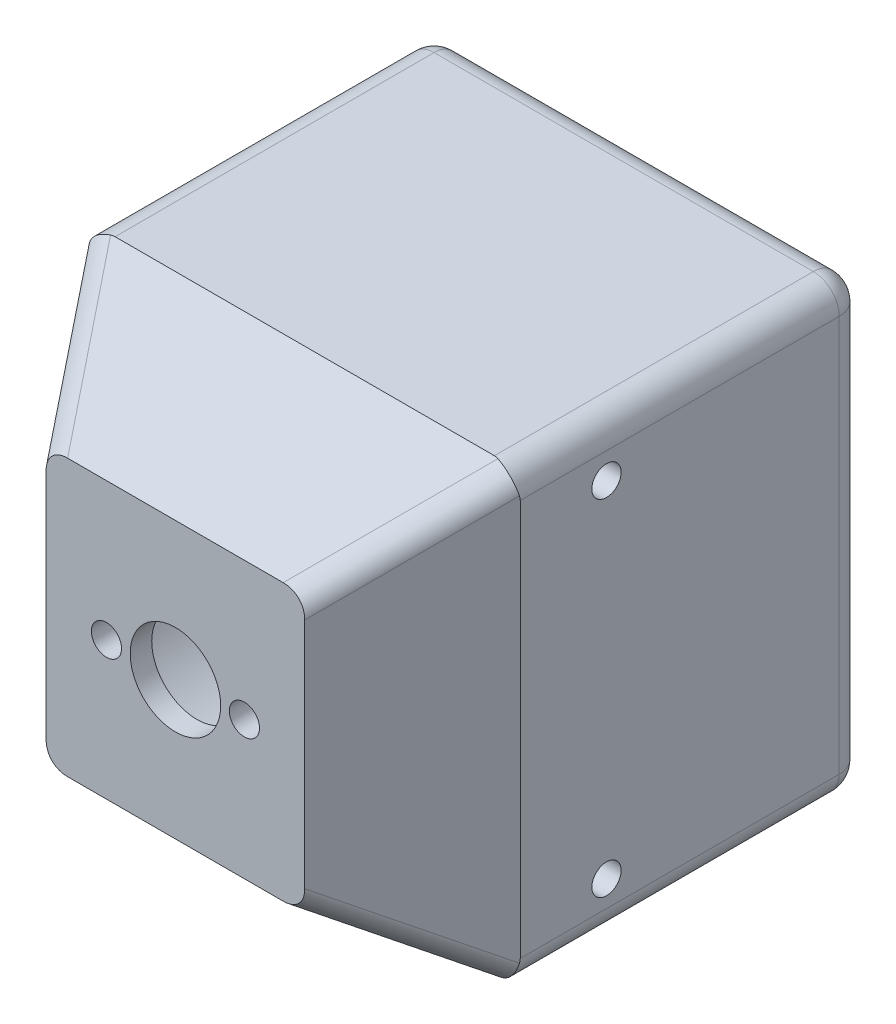
from build123d import *

# Parameters (mm, degrees)
SKETCH1_W           = 50
SKETCH1_H           = 52
BOSS_EXTRUDE1_DEPTH = 82.5
SKETCH2_R           = 15
CUT_EXTRUDE1_DEPTH  = 80
SKETCH3_R           = 5.25
SKETCH3_R_2         = 1.75
CUT_EXTRUDE2_DEPTH  = 91.040268769
SKETCH4_R           = 1.7
CUT_EXTRUDE4_DEPTH  = 100.911210582
SKETCH6_W           = 27.5
SKETCH6_H           = 52
CUT_EXTRUDE5_DEPTH  = 100.911210582
CUT_EXTRUDE6_DEPTH  = 100.911210582
CUT_EXTRUDE7_DEPTH  = 101.673978763
FILLET1_R           = 3


with BuildPart() as part:
    # Sketch1 → Boss-Extrude1 (new body)
    with BuildSketch(Plane.XY):
        Rectangle(SKETCH1_W, SKETCH1_H)
    extrude(amount=BOSS_EXTRUDE1_DEPTH)

    # Sketch2 → Cut-Extrude1 (cut)
    with BuildSketch(Plane(origin=(0, 0, 0), x_dir=(-1, 0, 0), z_dir=(0, 0, -1))):
        Circle(SKETCH2_R)
    extrude(amount=-CUT_EXTRUDE1_DEPTH, mode=Mode.SUBTRACT)

    # Sketch3 → Cut-Extrude2 (cut, through all)
    with BuildSketch(Plane.XY.offset(82.5)):
        Circle(SKETCH3_R)
        with Locations((-8, 0)):
            Circle(SKETCH3_R_2)
        with Locations(Location((8, 0, 0), (0, 0, 180))):
            Circle(SKETCH3_R_2)
    extrude(amount=-CUT_EXTRUDE2_DEPTH, mode=Mode.SUBTRACT)

    # Sketch4 → Cut-Extrude4 (cut, through all)
    with BuildSketch(Plane(origin=(25, 0, 0), x_dir=(0, 0, -1), z_dir=(1, 0, 0))):
        with Locations(Location((-57.5, 20, 0), (0, 0, 90))):
            Circle(SKETCH4_R)
        with Locations(Location((-57.5, -20, 0), (0, 0, 270))):
            Circle(SKETCH4_R)
    extrude(amount=-CUT_EXTRUDE4_DEPTH, mode=Mode.SUBTRACT)

    # Sketch6 → Cut-Extrude5 (cut, through all)
    with BuildSketch(Plane(origin=(25, 0, 0), x_dir=(0, 0, -1), z_dir=(1, 0, 0))):
        with Locations((-13.75, 0)):
            Rectangle(SKETCH6_W, SKETCH6_H)
    extrude(amount=-CUT_EXTRUDE5_DEPTH, mode=Mode.SUBTRACT)

    # Sketch9 → Cut-Extrude6 (cut, through all)
    with BuildSketch(Plane(origin=(25, 0, 0), x_dir=(0, 0, -1), z_dir=(1, 0, 0))):
        Polygon((-82.5, 26), (-82.5, 16), (-67.5, 26), align=None)
        Polygon((-82.5, -16), (-67.5, -26), (-82.5, -26), align=None)
    extrude(amount=-CUT_EXTRUDE6_DEPTH, mode=Mode.SUBTRACT)

    # Sketch10 → Cut-Extrude7 (cut, through all)
    with BuildSketch(Plane.XZ.offset(26)):
        Polygon((15, 82.5), (25, 67.5), (25, 82.5), align=None)
        Polygon((-25, 67.5), (-25, 82.5), (-15, 82.5), align=None)
    extrude(amount=-CUT_EXTRUDE7_DEPTH, mode=Mode.SUBTRACT)

    # Fillet1
    # the kernel refuses this fillet: 3 mm, written as the material it takes off along each edge
    with BuildSketch(Plane(origin=(-22, 23, 30.5), x_dir=(-1, 0, 0), z_dir=(0, 1, 0))) as fillet1_piece_1_section:
        Polygon((0, 0), (FILLET1_R, 0), (FILLET1_R, -FILLET1_R), (0, -FILLET1_R), align=None)
    fillet1_piece_1 = extrude(amount=FILLET1_R, mode=Mode.PRIVATE)
    fillet1_piece_1 = fillet1_piece_1 - Plane(origin=(-22, 23, 30.5), x_dir=(0.7071067811865475, 0, 0.7071067811865475), z_dir=(0, 1, 0)) * Sphere(FILLET1_R, mode=Mode.PRIVATE)
    add(fillet1_piece_1, mode=Mode.SUBTRACT)
    with BuildSketch(Plane(origin=(-22, -23, 30.5), x_dir=(0, 0, -1), z_dir=(-1, 0, 0))) as fillet1_piece_2_section:
        Polygon((0, 0), (FILLET1_R, 0), (FILLET1_R, FILLET1_R), (0, FILLET1_R), align=None)
    fillet1_piece_2 = extrude(amount=FILLET1_R, mode=Mode.PRIVATE)
    fillet1_piece_2 = fillet1_piece_2 - Plane(origin=(-22, -23, 30.5), x_dir=(0, 0.7071067811865475, 0.7071067811865475), z_dir=(-1, 0, 0)) * Sphere(FILLET1_R, mode=Mode.PRIVATE)
    add(fillet1_piece_2, mode=Mode.SUBTRACT)
    with BuildSketch(Plane(origin=(22, -23, 30.5), x_dir=(0, 0, -1), z_dir=(1, 0, 0))) as fillet1_piece_3_section:
        Polygon((0, 0), (FILLET1_R, 0), (FILLET1_R, -FILLET1_R), (0, -FILLET1_R), align=None)
    fillet1_piece_3 = extrude(amount=FILLET1_R, mode=Mode.PRIVATE)
    fillet1_piece_3 = fillet1_piece_3 - Plane(origin=(22, -23, 30.5), x_dir=(0, 0.7071067811865475, 0.7071067811865475), z_dir=(1, 0, 0)) * Sphere(FILLET1_R, mode=Mode.PRIVATE)
    add(fillet1_piece_3, mode=Mode.SUBTRACT)
    with BuildSketch(Plane(origin=(22, 23, 30.5), x_dir=(1, 0, 0), z_dir=(0, 1, 0))) as fillet1_piece_4_section:
        Polygon((0, 0), (FILLET1_R, 0), (FILLET1_R, FILLET1_R), (0, FILLET1_R), align=None)
    fillet1_piece_4 = extrude(amount=FILLET1_R, mode=Mode.PRIVATE)
    fillet1_piece_4 = fillet1_piece_4 - Plane(origin=(22, 23, 30.5), x_dir=(-0.7071067811865475, 0, 0.7071067811865475), z_dir=(0, 1, 0)) * Sphere(FILLET1_R, mode=Mode.PRIVATE)
    add(fillet1_piece_4, mode=Mode.SUBTRACT)
    with BuildSketch(Plane(origin=(12.352941176, -13.352941176, 86.470588235), x_dir=(0.26906911759852636, 0.8744746321952062, -0.40360367639778677), z_dir=(0.4850712500726659, -0.4850712500726661, -0.7276068751089989)), Plane(origin=(12.352941176, 13.352941176, 86.470588235), x_dir=(-0.8744746321952062, 0.26906911759852264, -0.4036036763977888), z_dir=(0.4850712500726658, 0.48507125007266627, -0.7276068751089988))) as fillet1_piece_5:
        with BuildLine():
            CenterArc((FILLET1_R * 0.727606875109, -FILLET1_R), FILLET1_R, 90, 72.079786861)
            Line((-FILLET1_R * 0.223879038495, -FILLET1_R * 0.692307692308), (0, 0))
            Line((0, 0), (FILLET1_R * 0.727606875109, 0))
        make_face()
    extrude(amount=31.529631255, mode=Mode.SUBTRACT)
    with BuildSketch(Plane(origin=(-12.352941176, -13.352941176, 86.470588235), x_dir=(-0.26906911759852215, 0.8744746321952062, -0.4036036763977897), z_dir=(-0.485071250072666, -0.48507125007266627, -0.7276068751089988)), Plane(origin=(-12.352941176, 13.352941176, 86.470588235), x_dir=(0.8744746321952063, 0.2690691175985245, -0.40360367639778794), z_dir=(-0.485071250072666, 0.48507125007266605, -0.7276068751089988))) as fillet1_piece_6:
        with BuildLine():
            CenterArc((FILLET1_R * 0.727606875109, FILLET1_R), FILLET1_R, 197.920213139, 72.079786861)
            Line((-FILLET1_R * 0.223879038495, FILLET1_R * 0.692307692308), (0, 0))
            Line((0, 0), (FILLET1_R * 0.727606875109, 0))
        make_face()
    extrude(amount=31.529631255, mode=Mode.SUBTRACT)
    with BuildSketch(Plane(origin=(-25, 23, 27.5), x_dir=(0, 0, 1), z_dir=(0, -1, 0)), Plane(origin=(25, -23, 27.5), x_dir=(0, 0, 1), z_dir=(0, 1, 0))) as fillet1_piece_7:
        with BuildLine():
            CenterArc((FILLET1_R, -FILLET1_R), FILLET1_R, 90, 90)
            Line((0, -FILLET1_R), (0, 0))
            Line((0, 0), (FILLET1_R, 0))
        make_face()
    extrude(amount=46, mode=Mode.SUBTRACT)
    with BuildSketch(Plane(origin=(22, -26, 27.5), x_dir=(0, 1, 0), z_dir=(-1, 0, 0)), Plane(origin=(22, 26, 27.5), x_dir=(0, 0, 1), z_dir=(-1, 0, 0))) as fillet1_piece_8:
        with BuildLine():
            CenterArc((FILLET1_R, -FILLET1_R), FILLET1_R, 90, 90)
            Line((0, -FILLET1_R), (0, 0))
            Line((0, 0), (FILLET1_R, 0))
        make_face()
    extrude(amount=44, mode=Mode.SUBTRACT)
    with BuildSketch(Plane(origin=(0, 0, 27.5), x_dir=(-1, 0, 0), z_dir=(0, -1, 0))) as fillet1_piece_9:
        with BuildLine():
            CenterArc((15 + FILLET1_R, -FILLET1_R), FILLET1_R, 90, 90)
            Line((15, -FILLET1_R), (15, 0))
            Line((15, 0), (15 + FILLET1_R, 0))
        make_face()
    revolve(axis=Axis((0, 0, 27.5), (0, 0, -1)), mode=Mode.SUBTRACT)
    with BuildSketch(Plane(origin=(-25, -26, 30.5), x_dir=(0, 1, 0), z_dir=(0, 0, 1)), Plane(origin=(-25, 26, 30.5), x_dir=(1, 0, 0), z_dir=(0, 0, 1))) as fillet1_piece_10:
        with BuildLine():
            CenterArc((FILLET1_R, -FILLET1_R), FILLET1_R, 90, 90)
            Line((0, -FILLET1_R), (0, 0))
            Line((0, 0), (FILLET1_R, 0))
        make_face()
    extrude(amount=44.5, mode=Mode.SUBTRACT)
    with BuildSketch(Plane(origin=(25, -26, 30.5), x_dir=(0, 1, 0), z_dir=(0, 0, 1)), Plane(origin=(25, 26, 30.5), x_dir=(-1, 0, 0), z_dir=(0, 0, 1))) as fillet1_piece_11:
        with BuildLine():
            CenterArc((FILLET1_R, FILLET1_R), FILLET1_R, 180, 90)
            Line((0, FILLET1_R), (0, 0))
            Line((0, 0), (FILLET1_R, 0))
        make_face()
    extrude(amount=44.5, mode=Mode.SUBTRACT)


solid = part.part
